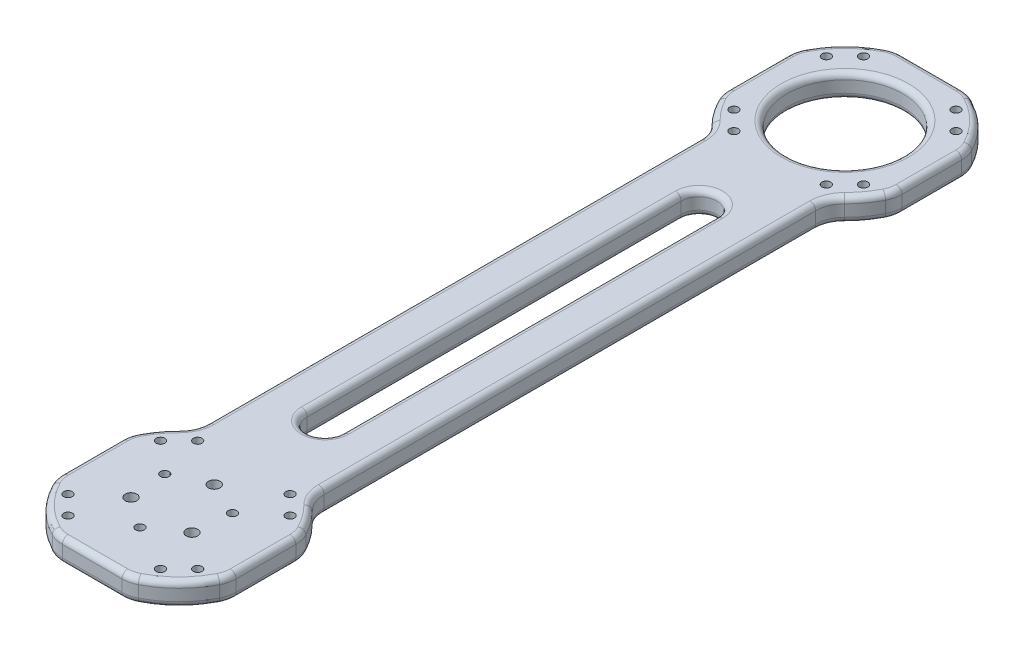
from build123d import *

# Parameters (mm, degrees)
SKETCH_1_R               = 1.5
SKETCH_1_R_2             = 2
SKETCH_1_R_3             = 20
EXTRUDE_1_DEPTH          = 8
FILLET_1_R               = 2
CUT_EXTRUDE_1_DEPTH      = 18
CUT_EXTRUDE_1_DEPTH_BACK = 21.5
FILLET_2_R               = 2


with BuildPart() as part:
    # 草图1 → 凸台-拉伸1 (new body)
    with BuildSketch(Plane(origin=(0, 0, 0), x_dir=(1, 0, 0), z_dir=(0, 1, 0))):
        with BuildLine():
            Line((-20, -84.896013553), (-20, 84.896013553))
            ThreePointArc((-20, 84.896013553), (-20.764518548, 88.730838497), (-22.941176471, 91.979304482))
            ThreePointArc((-22.941176471, 91.979304482), (-26.232042756, 95.813287596), (-28.888888889, 100.111007463))
            ThreePointArc((-28.888888889, 100.111007463), (-29.718253158, 102.335213332), (-30, 104.692235936))
            Line((-30, 104.692235936), (-30, 125.307764064))
            ThreePointArc((-30, 125.307764064), (-29.718253158, 127.664786668), (-28.888888889, 129.888992537))
            ThreePointArc((-28.888888889, 129.888992537), (-22.980970389, 137.980970389), (-14.888992537, 143.888888889))
            ThreePointArc((-14.888992537, 143.888888889), (-12.664786668, 144.718253158), (-10.307764064, 145))
            Line((-10.307764064, 145), (10.307764064, 145))
            ThreePointArc((10.307764064, 145), (12.664786668, 144.718253158), (14.888992537, 143.888888889))
            ThreePointArc((14.888992537, 143.888888889), (22.980970389, 137.980970389), (28.888888889, 129.888992537))
            ThreePointArc((28.888888889, 129.888992537), (29.718253158, 127.664786668), (30, 125.307764064))
            Line((30, 125.307764064), (30, 104.692235936))
            ThreePointArc((30, 104.692235936), (29.718253158, 102.335213332), (28.888888889, 100.111007463))
            ThreePointArc((28.888888889, 100.111007463), (26.232042756, 95.813287596), (22.941176471, 91.979304482))
            ThreePointArc((22.941176471, 91.979304482), (20.764518548, 88.730838497), (20, 84.896013553))
            Line((20, 84.896013553), (20, -84.896013553))
            ThreePointArc((20, -84.896013553), (20.764518548, -88.730838497), (22.941176471, -91.979304482))
            ThreePointArc((22.941176471, -91.979304482), (26.232042756, -95.813287596), (28.888888889, -100.111007463))
            ThreePointArc((28.888888889, -100.111007463), (29.718253158, -102.335213332), (30, -104.692235936))
            Line((30, -104.692235936), (30, -125.307764064))
            ThreePointArc((30, -125.307764064), (29.718253158, -127.664786668), (28.888888889, -129.888992537))
            ThreePointArc((28.888888889, -129.888992537), (22.980970389, -137.980970389), (14.888992537, -143.888888889))
            ThreePointArc((14.888992537, -143.888888889), (12.664786668, -144.718253158), (10.307764064, -145))
            Line((10.307764064, -145), (-10.307764064, -145))
            ThreePointArc((-10.307764064, -145), (-12.664786668, -144.718253158), (-14.888992537, -143.888888889))
            ThreePointArc((-14.888992537, -143.888888889), (-22.980970389, -137.980970389), (-28.888888889, -129.888992537))
            ThreePointArc((-28.888888889, -129.888992537), (-29.718253158, -127.664786668), (-30, -125.307764064))
            Line((-30, -125.307764064), (-30, -104.692235936))
            ThreePointArc((-30, -104.692235936), (-29.718253158, -102.335213332), (-28.888888889, -100.111007463))
            ThreePointArc((-28.888888889, -100.111007463), (-26.232042756, -95.813287596), (-22.941176471, -91.979304482))
            ThreePointArc((-22.941176471, -91.979304482), (-20.764518548, -88.730838497), (-20, -84.896013553))
        make_face()
        with Locations((-15.969331282, -92.611823245)):
            Circle(SKETCH_1_R, mode=Mode.SUBTRACT)
        with Locations((15.969331282, -92.611823245)):
            Circle(SKETCH_1_R, mode=Mode.SUBTRACT)
        with Locations((-22.388176755, -130.969331282)):
            Circle(SKETCH_1_R, mode=Mode.SUBTRACT)
        with Locations((-22.388176755, -99.030668718)):
            Circle(SKETCH_1_R, mode=Mode.SUBTRACT)
        with Locations((-15.969331282, -137.388176755)):
            Circle(SKETCH_1_R, mode=Mode.SUBTRACT)
        with Locations((15.969331282, -137.388176755)):
            Circle(SKETCH_1_R, mode=Mode.SUBTRACT)
        with Locations((22.388176755, -130.969331282)):
            Circle(SKETCH_1_R, mode=Mode.SUBTRACT)
        with Locations((22.388176755, -99.030668718)):
            Circle(SKETCH_1_R, mode=Mode.SUBTRACT)
        with Locations((0, -102.85)):
            Circle(SKETCH_1_R_2, mode=Mode.SUBTRACT)
        with Locations((10.522208656, -121.075)):
            Circle(SKETCH_1_R_2, mode=Mode.SUBTRACT)
        with Locations((-10.522208656, -121.075)):
            Circle(SKETCH_1_R_2, mode=Mode.SUBTRACT)
        with Locations((0, -128.5)):
            Circle(SKETCH_1_R, mode=Mode.SUBTRACT)
        with Locations((-11.691342951, -108.25)):
            Circle(SKETCH_1_R, mode=Mode.SUBTRACT)
        with Locations((11.691342951, -108.25)):
            Circle(SKETCH_1_R, mode=Mode.SUBTRACT)
        with Locations((22.388176755, 99.030668718)):
            Circle(SKETCH_1_R, mode=Mode.SUBTRACT)
        with Locations((22.388176755, 130.969331282)):
            Circle(SKETCH_1_R, mode=Mode.SUBTRACT)
        with Locations((15.969331282, 137.388176755)):
            Circle(SKETCH_1_R, mode=Mode.SUBTRACT)
        with Locations((-15.969331282, 137.388176755)):
            Circle(SKETCH_1_R, mode=Mode.SUBTRACT)
        with Locations((-22.388176755, 99.030668718)):
            Circle(SKETCH_1_R, mode=Mode.SUBTRACT)
        with Locations((-22.388176755, 130.969331282)):
            Circle(SKETCH_1_R, mode=Mode.SUBTRACT)
        with Locations((15.969331282, 92.611823245)):
            Circle(SKETCH_1_R, mode=Mode.SUBTRACT)
        with Locations((-15.969331282, 92.611823245)):
            Circle(SKETCH_1_R, mode=Mode.SUBTRACT)
        with Locations((0, 115)):
            Circle(SKETCH_1_R_3, mode=Mode.SUBTRACT)
    extrude(amount=EXTRUDE_1_DEPTH)

    # 圆角1
    fillet_1_edges = [part.edges().sort_by_distance(p)[0] for p in [
        (-20.764518548, 8, -88.730838497),
        (-26.232042756, 8, -95.813287596),
        (-29.718253158, 8, -102.335213332),
        (-30, 8, -115),
        (-29.718253158, 8, -127.664786668),
        (-22.980970389, 8, -137.980970389),
        (-12.664786668, 8, -144.718253158),
        (0, 8, -145),
        (12.664786668, 8, -144.718253158),
        (22.980970389, 8, -137.980970389),
        (29.718253158, 8, -127.664786668),
        (30, 8, -115),
        (29.718253158, 8, -102.335213332),
        (26.232042756, 8, -95.813287596),
        (20.764518548, 8, -88.730838497),
        (20, 8, 0),
        (20.764518548, 8, 88.730838497),
        (26.232042756, 8, 95.813287596),
        (29.718253158, 8, 102.335213332),
        (30, 8, 115),
        (29.718253158, 8, 127.664786668),
        (22.980970389, 8, 137.980970389),
        (12.664786668, 8, 144.718253158),
        (0, 8, 145),
        (-12.664786668, 8, 144.718253158),
        (-22.980970389, 8, 137.980970389),
        (-29.718253158, 8, 127.664786668),
        (-30, 8, 115),
        (-29.718253158, 8, 102.335213332),
        (-26.232042756, 8, 95.813287596),
        (-20.764518548, 8, 88.730838497),
        (-20, 8, 0),
        (-20, 8, -115),
        (-20, 0, -115),
    ]]
    fillet(fillet_1_edges, radius=FILLET_1_R)

    # 草图2 → 切除-拉伸1 (cut, two sides: drawn at the far end of the back side and taken through both)
    with BuildSketch(Plane.XZ.offset(-CUT_EXTRUDE_1_DEPTH_BACK)):
        with BuildLine():
            Line((6.151913725, 64.600455658), (6.151913725, -64.600455658))
            ThreePointArc((6.151913725, -64.600455658), (0, -70.752369383), (-6.151913725, -64.600455658))
            Line((-6.151913725, -64.600455658), (-6.151913725, 64.600455658))
            ThreePointArc((-6.151913725, 64.600455658), (0, 70.752369383), (6.151913725, 64.600455658))
        make_face()
    extrude(amount=CUT_EXTRUDE_1_DEPTH + CUT_EXTRUDE_1_DEPTH_BACK, mode=Mode.SUBTRACT)

    # 圆角2
    fillet_2_edges = [part.edges().sort_by_distance(p)[0] for p in [
        (0, 8, -70.752369383),
        (-6.151913725, 8, 0),
        (0, 8, 70.752369383),
        (0, 0, -70.752369383),
        (-6.151913725, 0, 0),
        (0, 0, 70.752369383),
        (-20.764518548, 0, -88.730838497),
        (-26.232042756, 0, -95.813287596),
        (-29.718253158, 0, -102.335213332),
        (-30, 0, -115),
        (-29.718253158, 0, -127.664786668),
        (-22.980970389, 0, -137.980970389),
        (-12.664786668, 0, -144.718253158),
        (0, 0, -145),
        (12.664786668, 0, -144.718253158),
        (22.980970389, 0, -137.980970389),
        (29.718253158, 0, -127.664786668),
        (30, 0, -115),
        (29.718253158, 0, -102.335213332),
        (26.232042756, 0, -95.813287596),
        (20.764518548, 0, -88.730838497),
        (20, 0, 0),
        (20.764518548, 0, 88.730838497),
        (26.232042756, 0, 95.813287596),
        (29.718253158, 0, 102.335213332),
        (30, 0, 115),
        (29.718253158, 0, 127.664786668),
        (22.980970389, 0, 137.980970389),
        (12.664786668, 0, 144.718253158),
        (0, 0, 145),
        (-12.664786668, 0, 144.718253158),
        (-22.980970389, 0, 137.980970389),
        (-29.718253158, 0, 127.664786668),
        (-30, 0, 115),
        (-29.718253158, 0, 102.335213332),
        (-26.232042756, 0, 95.813287596),
        (-20.764518548, 0, 88.730838497),
        (6.151913725, 8, 0),
        (6.151913725, 0, 0),
        (-20, 0, 0),
    ]]
    fillet(fillet_2_edges, radius=FILLET_2_R)


solid = part.part
